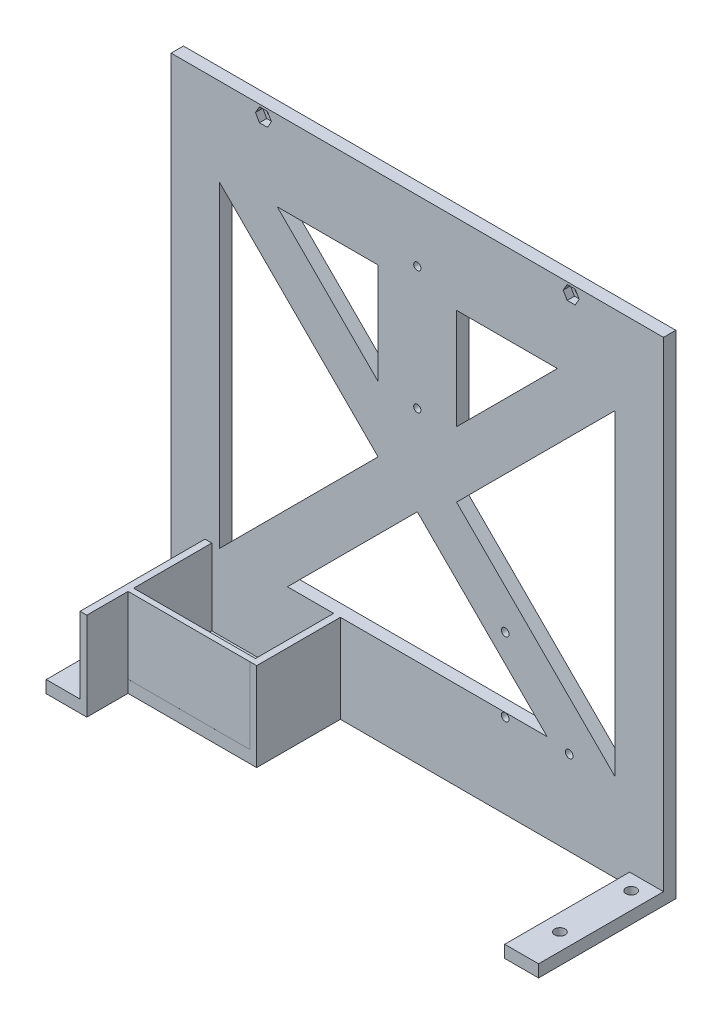
from build123d import *

# Parameters (mm, degrees)
SKETCH1_W           = 203.2
SKETCH1_H           = 203.2
SKETCH1_R           = 1.5
BOSS_EXTRUDE1_DEPTH = 5.08
SKETCH2_W           = 13.97
SKETCH2_H           = 5.08
BOSS_EXTRUDE2_DEPTH = 51.562
CUT_EXTRUDE1_REACH  = 231.744
SKETCH3_R           = 2.159
CUT_EXTRUDE2_REACH  = 154.656
SKETCH7_R           = 1.5875
BOSS_EXTRUDE6_REACH = 181.07
SKETCH8_W           = 2.3
SKETCH8_H           = 31.385365186
SKETCH10_W          = 17.01
SKETCH10_H          = 36.465365186
CUT_EXTRUDE3_DEPTH  = 53.09
CUT_EXTRUDE4_START  = -3
SKETCH11_R          = 1.5
CUT_EXTRUDE4_DEPTH  = 3


with BuildPart() as part:
    # Sketch1 → Boss-Extrude1 (new body)
    with BuildSketch(Plane.XY):
        Rectangle(SKETCH1_W, SKETCH1_H)
        Polygon((53.588290096, -65.134634814), (-53.588290096, -65.134634814), (0, -11.546344718), align=None, mode=Mode.SUBTRACT)
        Polygon((-81.543221181, -65.354531679), (-81.543221181, 65.354531679), (-16.188689502, 0), align=None, mode=Mode.SUBTRACT)
        Polygon((81.543221181, -65.354531679), (16.188689502, 0), (81.543221181, 65.354531679), align=None, mode=Mode.SUBTRACT)
        Polygon((-57.815177682, 68.567256543), (-16.188689502, 68.567256543), (-16.188689502, 26.940768363), align=None, mode=Mode.SUBTRACT)
        with Locations((0, 25.4)):
            Circle(SKETCH1_R, mode=Mode.SUBTRACT)
        with Locations((-63.5, 97.79)):
            Circle(SKETCH1_R, mode=Mode.SUBTRACT)
        with Locations((0, 76.2)):
            Circle(SKETCH1_R, mode=Mode.SUBTRACT)
        Polygon((57.815177682, 68.567256543), (16.188689502, 26.940768363), (16.188689502, 68.567256543), align=None, mode=Mode.SUBTRACT)
        with Locations((63.5, 97.79)):
            Circle(SKETCH1_R, mode=Mode.SUBTRACT)
    extrude(amount=BOSS_EXTRUDE1_DEPTH)

    # Sketch2 → Boss-Extrude2 (add)
    with BuildSketch(Plane.XY.offset(5.08)):
        Polygon((-101.6, -96.52), (-101.6, -101.6), (-31.75, -101.6), (-31.75, -65.134634814), (-34.544, -65.134634814), (-34.544, -96.52), (-84.836, -96.52), (-84.836, -65.134634814), (-87.63, -65.134634814), (-87.63, -96.52), align=None)
        with Locations((94.615, -99.06)):
            Rectangle(SKETCH2_W, SKETCH2_H)
    extrude(amount=BOSS_EXTRUDE2_DEPTH)

    # Sketch3 → Cut-Extrude1 (cut, up to next)
    with BuildSketch(Plane(origin=(0, -96.52, 0), x_dir=(1, 0, 0), z_dir=(0, 1, 0)), mode=Mode.PRIVATE) as cut_extrude1_sk1:
        with Locations((-94.615, -11.43)):
            Circle(SKETCH3_R)
    cut_extrude1_tool1 = extrude(cut_extrude1_sk1.sketch, amount=-CUT_EXTRUDE1_REACH, mode=Mode.PRIVATE) & part.part
    # Sketch3 → Cut-Extrude1 (cut, up to next)
    with BuildSketch(Plane(origin=(0, -96.52, 0), x_dir=(1, 0, 0), z_dir=(0, 1, 0)), mode=Mode.PRIVATE) as cut_extrude1_sk2:
        with Locations((94.615, -11.43)):
            Circle(SKETCH3_R)
    cut_extrude1_tool2 = extrude(cut_extrude1_sk2.sketch, amount=-CUT_EXTRUDE1_REACH, mode=Mode.PRIVATE) & part.part
    # Sketch3 → Cut-Extrude1 (cut, up to next)
    with BuildSketch(Plane(origin=(0, -96.52, 0), x_dir=(1, 0, 0), z_dir=(0, 1, 0)), mode=Mode.PRIVATE) as cut_extrude1_sk3:
        with Locations((-94.615, -40.84)):
            Circle(SKETCH3_R)
    cut_extrude1_tool3 = extrude(cut_extrude1_sk3.sketch, amount=-CUT_EXTRUDE1_REACH, mode=Mode.PRIVATE) & part.part
    # Sketch3 → Cut-Extrude1 (cut, up to next)
    with BuildSketch(Plane(origin=(0, -96.52, 0), x_dir=(1, 0, 0), z_dir=(0, 1, 0)), mode=Mode.PRIVATE) as cut_extrude1_sk4:
        with Locations((94.615, -40.84)):
            Circle(SKETCH3_R)
    cut_extrude1_tool4 = extrude(cut_extrude1_sk4.sketch, amount=-CUT_EXTRUDE1_REACH, mode=Mode.PRIVATE) & part.part
    add(cut_extrude1_tool1.solids().sort_by_distance((-94.615, -96.52, 11.43))[0], mode=Mode.SUBTRACT)
    add(cut_extrude1_tool2.solids().sort_by_distance((94.615, -96.52, 11.43))[0], mode=Mode.SUBTRACT)
    add(cut_extrude1_tool3.solids().sort_by_distance((-94.615, -96.52, 40.84))[0], mode=Mode.SUBTRACT)
    add(cut_extrude1_tool4.solids().sort_by_distance((94.615, -96.52, 40.84))[0], mode=Mode.SUBTRACT)

    # Sketch7 → Cut-Extrude2 (cut, up to next)
    with BuildSketch(Plane.XY.offset(5.08), mode=Mode.PRIVATE) as cut_extrude2_sk1:
        with Locations((36.287585831, -66.785318729)):
            Circle(SKETCH7_R)
    cut_extrude2_tool1 = extrude(cut_extrude2_sk1.sketch, amount=-CUT_EXTRUDE2_REACH, mode=Mode.PRIVATE) & part.part
    # Sketch7 → Cut-Extrude2 (cut, up to next)
    with BuildSketch(Plane.XY.offset(5.08), mode=Mode.PRIVATE) as cut_extrude2_sk2:
        with Locations((36.287585831, -36.432318729)):
            Circle(SKETCH7_R)
    cut_extrude2_tool2 = extrude(cut_extrude2_sk2.sketch, amount=-CUT_EXTRUDE2_REACH, mode=Mode.PRIVATE) & part.part
    # Sketch7 → Cut-Extrude2 (cut, up to next)
    with BuildSketch(Plane.XY.offset(5.08), mode=Mode.PRIVATE) as cut_extrude2_sk3:
        with Locations((62.703585831, -66.785318729)):
            Circle(SKETCH7_R)
    cut_extrude2_tool3 = extrude(cut_extrude2_sk3.sketch, amount=-CUT_EXTRUDE2_REACH, mode=Mode.PRIVATE) & part.part
    add(cut_extrude2_tool1.solids().sort_by_distance((36.287586, -66.785319, 5.08))[0], mode=Mode.SUBTRACT)
    add(cut_extrude2_tool2.solids().sort_by_distance((36.287586, -36.432319, 5.08))[0], mode=Mode.SUBTRACT)
    add(cut_extrude2_tool3.solids().sort_by_distance((62.703586, -66.785319, 5.08))[0], mode=Mode.SUBTRACT)

    # Sketch8 → Boss-Extrude6 (add, up to next)
    with BuildSketch(Plane.ZY.offset(34.544), mode=Mode.PRIVATE) as boss_extrude6_sk1:
        with Locations((38.48, -80.827317407)):
            Rectangle(SKETCH8_W, SKETCH8_H)
    boss_extrude6_tool1 = extrude(boss_extrude6_sk1.sketch, amount=BOSS_EXTRUDE6_REACH, mode=Mode.PRIVATE) - part.part
    add(boss_extrude6_tool1.solids().sort_by_distance((-34.544, -80.827317, 38.48))[0])

    # Sketch10 → Cut-Extrude3 (cut)
    with BuildSketch(Plane(origin=(-31.75, 0, 0), x_dir=(0, 0, -1), z_dir=(1, 0, 0))):
        with Locations((-48.137, -83.367317407)):
            Rectangle(SKETCH10_W, SKETCH10_H)
    extrude(amount=-CUT_EXTRUDE3_DEPTH, mode=Mode.SUBTRACT)

    # Sketch11 → Cut-Extrude4 (cut)
    # profile 1 of 2: a face of its own
    with BuildSketch(Plane.XY.offset(5.08).offset(CUT_EXTRUDE4_START)):
        Polygon((-65.145448267, 94.94), (-61.854551733, 94.94), (-60.209103466, 97.79), (-61.854551733, 100.64), (-65.145448267, 100.64), (-66.790896534, 97.79), align=None)
        with Locations((-63.5, 97.79)):
            Circle(SKETCH11_R, mode=Mode.SUBTRACT)
    # profile 2 of 2: a face of its own
    with BuildSketch(Plane.XY.offset(5.08).offset(CUT_EXTRUDE4_START)):
        Polygon((61.854551733, 94.94), (65.145448267, 94.94), (66.790896534, 97.79), (65.145448267, 100.64), (61.854551733, 100.64), (60.209103466, 97.79), align=None)
        with Locations((63.5, 97.79)):
            Circle(SKETCH11_R, mode=Mode.SUBTRACT)
    extrude(amount=CUT_EXTRUDE4_DEPTH, mode=Mode.SUBTRACT)


solid = part.part
